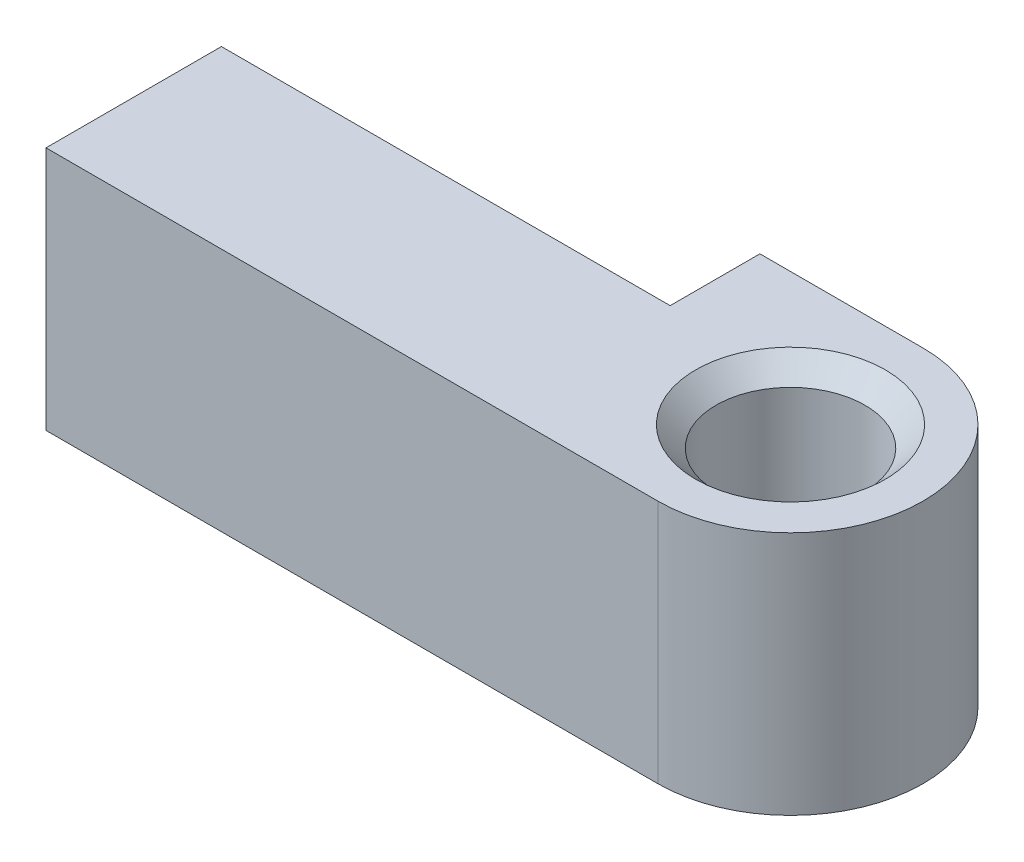
from build123d import *

# Parameters (mm, degrees)
SKETCH2_R           = 1.825
BOSS_EXTRUDE1_DEPTH = 6
CHAMFER1_SIZE       = 0.5


with BuildPart() as part:
    # Sketch2 → Boss-Extrude1 (new body)
    with BuildSketch(Plane(origin=(0, 0, 0), x_dir=(1, 0, 0), z_dir=(0, 1, 0))):
        with BuildLine():
            Line((11, 2.2), (15, 2.2))
            ThreePointArc((15, 2.2), (18.25, -1.05), (15, -4.3))
            Line((15, -4.3), (0, -4.3))
            Line((0, -4.3), (0, 0))
            Line((0, 0), (11, 0))
            Line((11, 0), (11, 2.2))
        make_face()
        with Locations((15, -1.05)):
            Circle(SKETCH2_R, mode=Mode.SUBTRACT)
    extrude(amount=BOSS_EXTRUDE1_DEPTH)

    # Chamfer1
    chamfer1_edges = [part.edges().sort_by_distance(p)[0] for p in [
        (13.175, 6, 1.05),
    ]]
    chamfer(chamfer1_edges, length=CHAMFER1_SIZE)


solid = part.part
